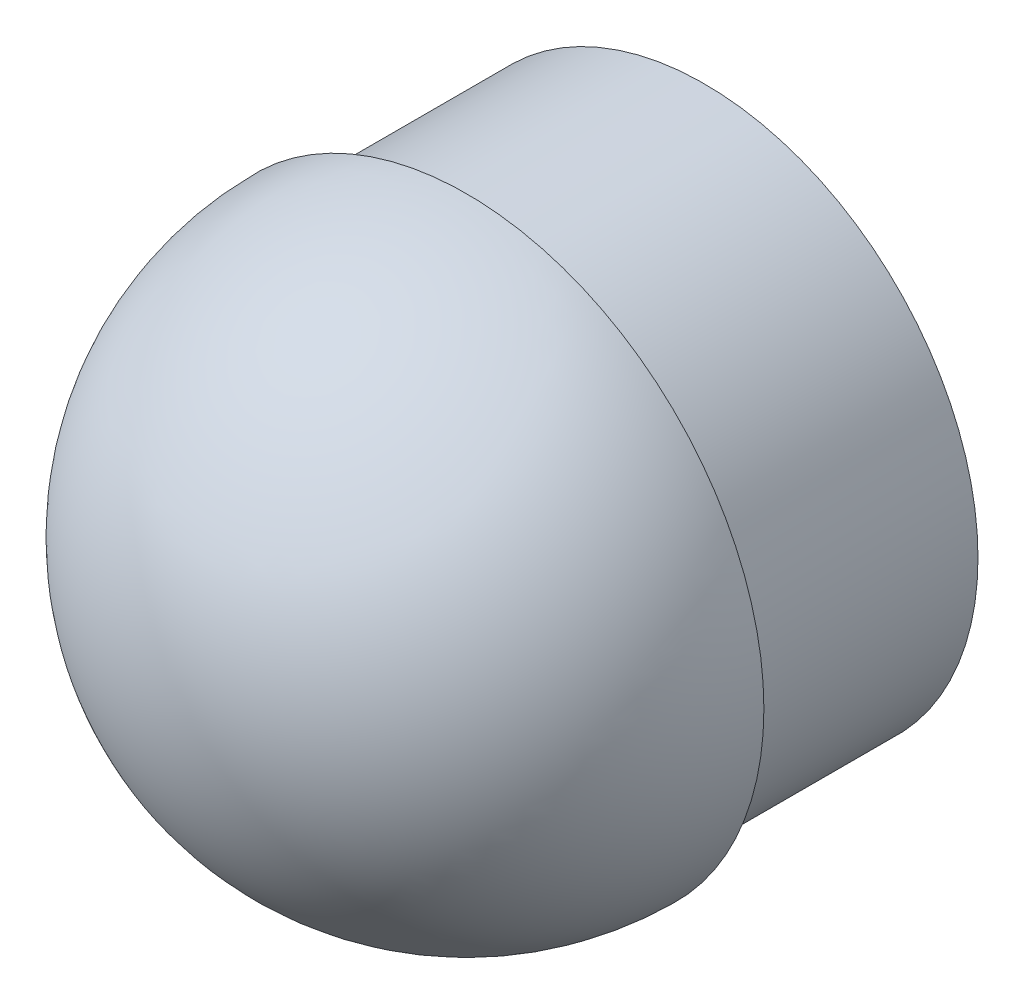
from build123d import *

# Parameters (mm, degrees)
SKETCH1_R           = 11.5
BOSS_EXTRUDE1_DEPTH = 10
SKETCH2_R           = 12.5
BOSS_EXTRUDE2_DEPTH = 12.5
FILLET1_R           = 12.5


with BuildPart() as part:
    # Sketch1 → Boss-Extrude1 (new body)
    with BuildSketch(Plane.XY):
        Circle(SKETCH1_R)
    extrude(amount=BOSS_EXTRUDE1_DEPTH)

    # Sketch2 → Boss-Extrude2 (add)
    with BuildSketch(Plane.XY.offset(10)):
        Circle(SKETCH2_R)
    extrude(amount=BOSS_EXTRUDE2_DEPTH)

    # Fillet1
    fillet1_edges = [part.edges().sort_by_distance(p)[0] for p in [
        (-12.5, 0, 22.5),
    ]]
    fillet(fillet1_edges, radius=FILLET1_R - 0.0001)  # a hair under: the kernel refuses the full size


solid = part.part
